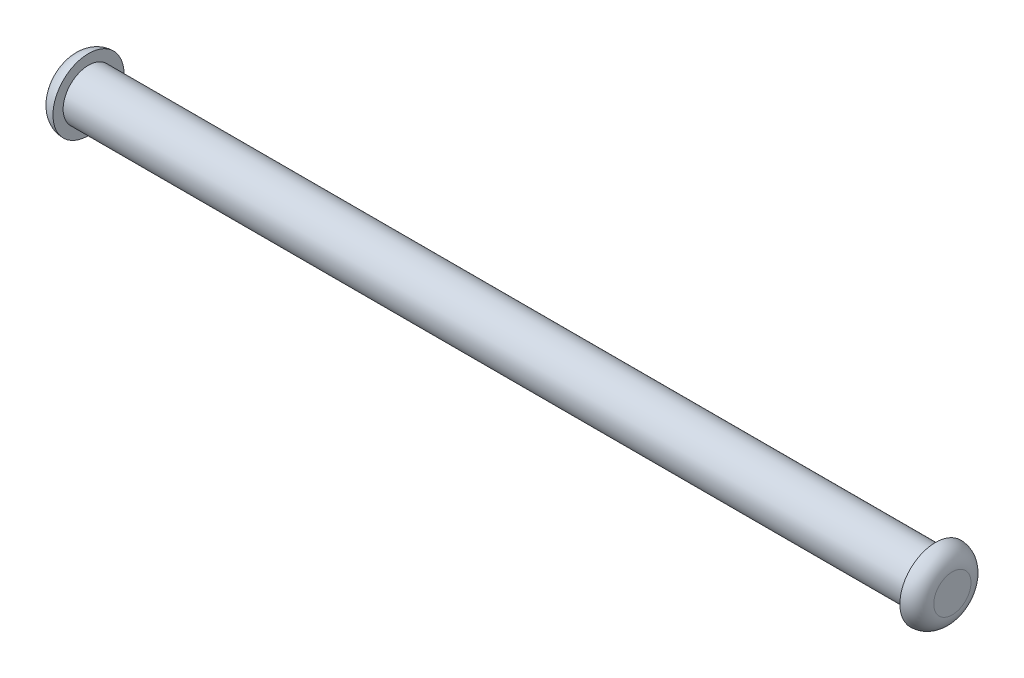
from build123d import *

# Parameters (mm, degrees)
SKETCH1_R           = 2.1
BOSS_EXTRUDE1_DEPTH = 1
SKETCH2_R           = 1.5
BOSS_EXTRUDE2_DEPTH = 50
SKETCH3_R           = 2.1
BOSS_EXTRUDE3_DEPTH = 1
FILLET1_R           = 1


with BuildPart() as part:
    # Sketch1 → Boss-Extrude1 (new body)
    with BuildSketch(Plane(origin=(0, 0, 0), x_dir=(0, 0, -1), z_dir=(1, 0, 0))):
        Circle(SKETCH1_R)
    extrude(amount=BOSS_EXTRUDE1_DEPTH)

    # Sketch2 → Boss-Extrude2 (add)
    with BuildSketch(Plane(origin=(1, 0, 0), x_dir=(0, 0, -1), z_dir=(1, 0, 0))):
        Circle(SKETCH2_R)
    extrude(amount=BOSS_EXTRUDE2_DEPTH)

    # Sketch3 → Boss-Extrude3 (add)
    with BuildSketch(Plane(origin=(51, 0, 0), x_dir=(0, 0, -1), z_dir=(1, 0, 0))):
        Circle(SKETCH3_R)
    extrude(amount=BOSS_EXTRUDE3_DEPTH)

    # Fillet1
    fillet1_edges = [part.edges().sort_by_distance(p)[0] for p in [
        (0, 0, 2.1),
        (52, 0, 2.1),
    ]]
    fillet(fillet1_edges, radius=FILLET1_R - 0.0001)  # a hair under: the kernel refuses the full size


solid = part.part
